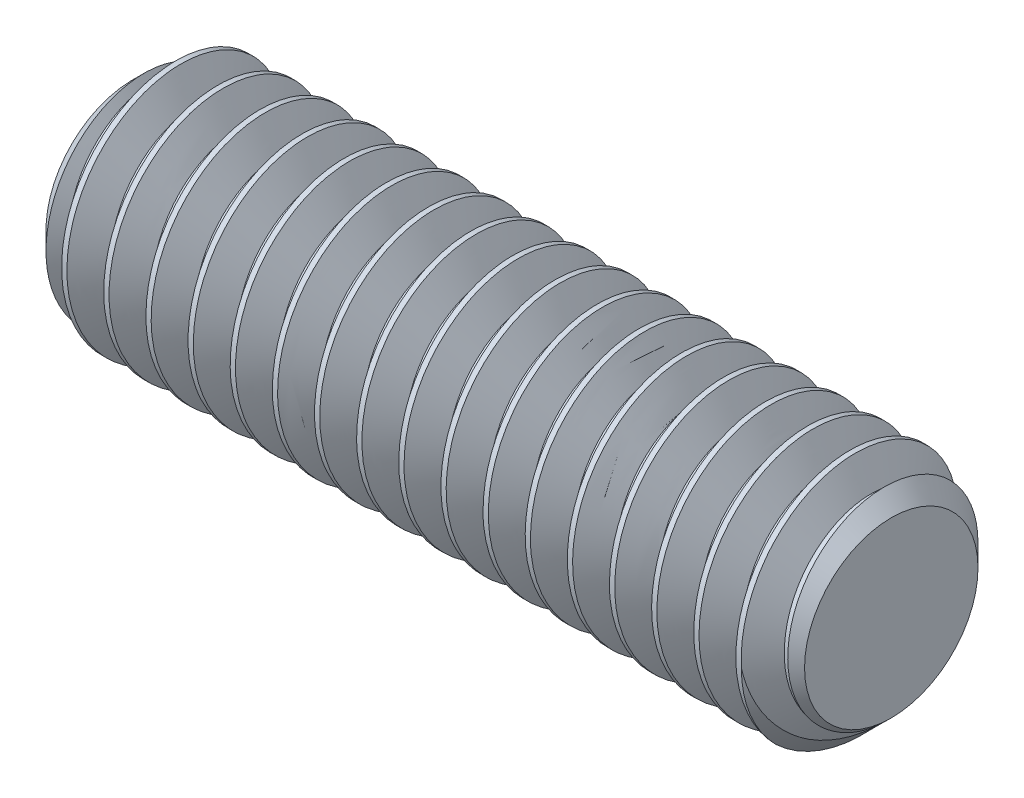
from build123d import *

# Parameters (mm, degrees)
BOSS_EXTRUDE1_DEPTH      = 12.7
BOSS_EXTRUDE1_DEPTH_BACK = 12.7
SKETCH2_R                = 3.9624
CHAMFER1_SIZE            = 1.058333333
CUT_SWEEP3_PITCH         = 1.411111111


with BuildPart() as part:
    # Sketch2 → Boss-Extrude1 (new, two sides: drawn at the far end of the back side and taken through both)
    with BuildSketch(Plane(origin=(0, 0, 0), x_dir=(0, 0, -1), z_dir=(1, 0, 0)).offset(-BOSS_EXTRUDE1_DEPTH_BACK)):
        Circle(SKETCH2_R)
    extrude(amount=BOSS_EXTRUDE1_DEPTH + BOSS_EXTRUDE1_DEPTH_BACK)

    # Chamfer1
    chamfer1_edges = [part.edges().sort_by_distance(p)[0] for p in [
        (-12.7, 0, 3.9624),
        (12.7, 0, 3.9624),
    ]]
    chamfer(chamfer1_edges, length=CHAMFER1_SIZE)

    # Cut-Sweep3: the profile of Sketch4 screwed along a right-hand helix of 19 turns, 8 arcs to a turn; built about Z, then put on its axis
    cut_sweep3_z = Axis((0, 0, 0), (0, 0, 1))
    cut_sweep3_corners = [(3.045856448, 0, -0.529166667), (4.038778629, 0, 0.044097222), (4.038778629, 0, -1.278819444), (3.045856448, 0, -0.705555556)]
    with BuildLine(mode=Mode.PRIVATE) as cut_sweep3_profile:
        Line(cut_sweep3_corners[0], cut_sweep3_corners[1])
        Line(cut_sweep3_corners[1], cut_sweep3_corners[2])
        Line(cut_sweep3_corners[2], cut_sweep3_corners[3])
        Line(cut_sweep3_corners[3], cut_sweep3_corners[0])
    cut_sweep3_cap = Face(cut_sweep3_profile.wire())
    cut_sweep3_turn_angles = [0, 22.5, 45, 67.5, 90, 112.5, 135, 157.5, 180, 202.5, 225, 247.5, 270, 292.5, 315, 337.5, 360]
    cut_sweep3_turn_weights = [1, 0.9238795325112867, 1, 0.9238795325112867, 1, 0.9238795325112867, 1, 0.9238795325112867, 1, 0.9238795325112867, 1, 0.9238795325112867, 1, 0.9238795325112867, 1, 0.9238795325112867, 1]
    cut_sweep3_turn_rails = [Edge.make_bspline([Vector(p[0], p[1], 0).rotate(cut_sweep3_z, cut_sweep3_turn_angles[k]) / cut_sweep3_turn_weights[k] + Vector(0, 0, p[2] + CUT_SWEEP3_PITCH * cut_sweep3_turn_angles[k] / 360) for k in range(17)], [0, 0, 0, 1, 1, 2, 2, 3, 3, 4, 4, 5, 5, 6, 6, 7, 7, 8, 8, 8], 2, cut_sweep3_turn_weights) for p in cut_sweep3_corners]
    cut_sweep3_turn_sides = [Face.make_surface_from_curves(cut_sweep3_turn_rails[p[0]], cut_sweep3_turn_rails[p[1]]) for p in [(0, 1), (1, 2), (2, 3), (3, 0)]]
    cut_sweep3 = Plane(origin=(12.7, 0, 0), x_dir=(0, 1, 0), z_dir=(-1, 0, 0)) * Solid(Shell([*[p.moved(Location((0, 0, CUT_SWEEP3_PITCH * i))) for i in range(19) for p in cut_sweep3_turn_sides], cut_sweep3_cap, cut_sweep3_cap.rotate(cut_sweep3_z, 6840).moved(Location((0, 0, CUT_SWEEP3_PITCH * 6840 / 360)))]))
    add(cut_sweep3, mode=Mode.SUBTRACT)


solid = part.part
